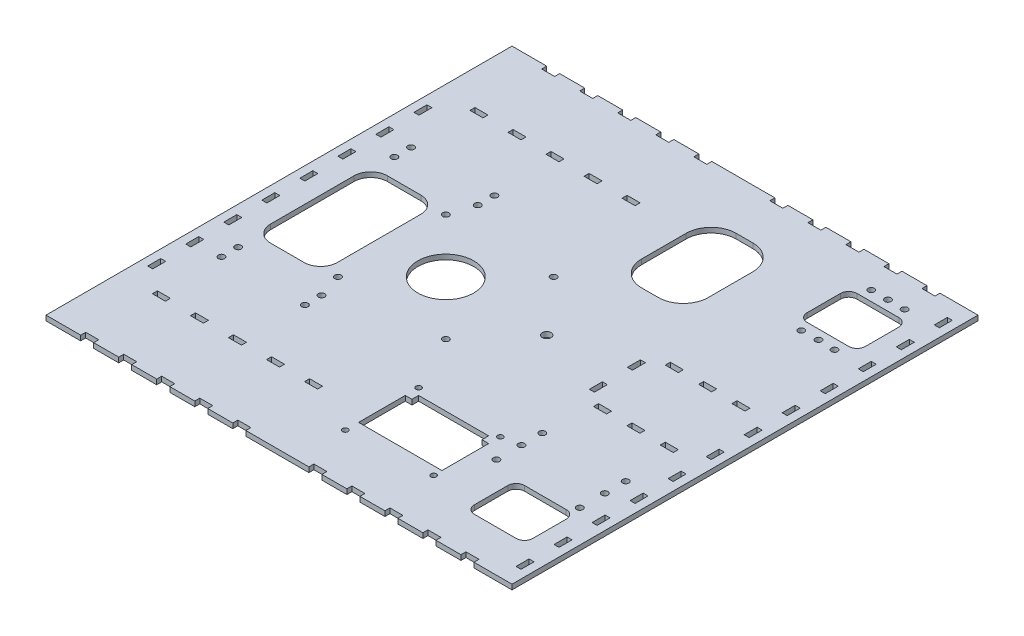
from build123d import *

# Parameters (mm, degrees)
SKETCH1_W                = 279.4
SKETCH1_H                = 279.4
BOSS_EXTRUDE1_DEPTH      = 3
SKETCH3_W                = 3
SKETCH3_H                = 7.8
CUT_EXTRUDE2_DEPTH       = 198.588410591
LPATTERN1_COUNT          = 12
LPATTERN1_PITCH          = 22.8
SKETCH5_W                = 7.8
SKETCH5_H                = 3
CUT_EXTRUDE3_DEPTH       = 198.588410591
LPATTERN2_COUNT          = 11
LPATTERN2_PITCH          = 22.8
MIRROR2_COPY_1_SKETCH_W  = 7.8
MIRROR2_COPY_1_SKETCH_H  = 3
MIRROR2_COPY_1_DEPTH     = 198.588410591
MIRROR2_COPY_2_SKETCH_W  = 7.8
MIRROR2_COPY_2_SKETCH_H  = 3
MIRROR2_COPY_2_DEPTH     = 198.588410591
MIRROR2_COPY_3_SKETCH_W  = 7.8
MIRROR2_COPY_3_SKETCH_H  = 3
MIRROR2_COPY_3_DEPTH     = 198.588410591
MIRROR2_COPY_4_SKETCH_W  = 7.8
MIRROR2_COPY_4_SKETCH_H  = 3
MIRROR2_COPY_4_DEPTH     = 198.588410591
MIRROR2_COPY_5_SKETCH_W  = 7.8
MIRROR2_COPY_5_SKETCH_H  = 3
MIRROR2_COPY_5_DEPTH     = 198.588410591
MIRROR2_COPY_6_SKETCH_W  = 7.8
MIRROR2_COPY_6_SKETCH_H  = 3
MIRROR2_COPY_6_DEPTH     = 198.588410591
MIRROR2_COPY_7_SKETCH_W  = 7.8
MIRROR2_COPY_7_SKETCH_H  = 3
MIRROR2_COPY_7_DEPTH     = 198.588410591
MIRROR2_COPY_8_SKETCH_W  = 7.8
MIRROR2_COPY_8_SKETCH_H  = 3
MIRROR2_COPY_8_DEPTH     = 198.588410591
MIRROR2_COPY_9_SKETCH_W  = 7.8
MIRROR2_COPY_9_SKETCH_H  = 3
MIRROR2_COPY_9_DEPTH     = 198.588410591
MIRROR2_COPY_10_SKETCH_W = 7.8
MIRROR2_COPY_10_SKETCH_H = 3
MIRROR2_COPY_10_DEPTH    = 198.588410591
SKETCH6_W                = 3
SKETCH6_H                = 7.8
CUT_EXTRUDE4_DEPTH       = 198.588410591
LPATTERN3_COUNT          = 8
LPATTERN3_PITCH          = 22.8
SKETCH7_R                = 16.75
CUT_EXTRUDE5_DEPTH       = 198.588410591
F_6_CLEARANCE_HOLE1_D    = 3.7973
F_6_CLEARANCE_HOLE2_D    = 3.7973
SKETCH14_R               = 2.65
CUT_EXTRUDE6_DEPTH       = 198.588410591
SKETCH16_W               = 7.8
SKETCH16_H               = 3
CUT_EXTRUDE8_DEPTH       = 198.588410591
LPATTERN5_COUNT          = 5
LPATTERN5_PITCH          = 22.8
MIRROR4_COPY_1_SKETCH_W  = 7.8
MIRROR4_COPY_1_SKETCH_H  = 3
MIRROR4_COPY_1_DEPTH     = 198.588410591
MIRROR4_COPY_2_SKETCH_W  = 7.8
MIRROR4_COPY_2_SKETCH_H  = 3
MIRROR4_COPY_2_DEPTH     = 198.588410591
MIRROR4_COPY_3_SKETCH_W  = 7.8
MIRROR4_COPY_3_SKETCH_H  = 3
MIRROR4_COPY_3_DEPTH     = 198.588410591
MIRROR4_COPY_4_SKETCH_W  = 7.8
MIRROR4_COPY_4_SKETCH_H  = 3
MIRROR4_COPY_4_DEPTH     = 198.588410591
MIRROR4_COPY_5_SKETCH_W  = 7.8
MIRROR4_COPY_5_SKETCH_H  = 3
MIRROR4_COPY_5_DEPTH     = 198.588410591
SKETCH17_W               = 7.8
SKETCH17_H               = 3
CUT_EXTRUDE9_DEPTH       = 198.588410591
LPATTERN6_COUNT          = 3
LPATTERN6_PITCH          = 20
SKETCH18_W               = 3
SKETCH18_H               = 7.8
CUT_EXTRUDE10_DEPTH      = 198.588410591
MIRROR5_COPY_1_SKETCH_W  = 7.8
MIRROR5_COPY_1_SKETCH_H  = 3
MIRROR5_COPY_1_DEPTH     = 198.588410591
MIRROR5_COPY_2_SKETCH_W  = 7.8
MIRROR5_COPY_2_SKETCH_H  = 3
MIRROR5_COPY_2_DEPTH     = 198.588410591
CUT_EXTRUDE11_DEPTH      = 198.588410591
F_4_CLEARANCE_HOLE1_D    = 3.2639
CUT_EXTRUDE12_REACH      = 199.588
F_6_CLEARANCE_HOLE3_D    = 3.7973


with BuildPart() as part:
    # Sketch1 → Boss-Extrude1 (new body)
    with BuildSketch(Plane(origin=(0, 0, 0), x_dir=(1, 0, 0), z_dir=(0, 1, 0))):
        Rectangle(SKETCH1_W, SKETCH1_H)
    extrude(amount=BOSS_EXTRUDE1_DEPTH)

    # Sketch3 → Cut-Extrude2 (cut, through all)
    with BuildSketch(Plane(origin=(0, 0, 0), x_dir=(-1, 0, 0), z_dir=(0, -1, 0))):
        with Locations((-133.2, 125.4)):
            Rectangle(SKETCH3_W, SKETCH3_H)
    cut_extrude2 = extrude(amount=-CUT_EXTRUDE2_DEPTH, mode=Mode.SUBTRACT)

    # LPattern1: Cut-Extrude2 ×12
    with Locations(*[(0, 0, i * LPATTERN1_PITCH) for i in range(1, LPATTERN1_COUNT)]):
        add(cut_extrude2, mode=Mode.SUBTRACT)

    # Sketch5 → Cut-Extrude3 (cut, through all)
    with BuildSketch(Plane.XZ):
        with Locations((113, -138.2)):
            Rectangle(SKETCH5_W, SKETCH5_H)
    cut_extrude3 = extrude(amount=-CUT_EXTRUDE3_DEPTH, mode=Mode.SUBTRACT)

    # LPattern2: Cut-Extrude3 ×11, 1 skipped
    with Locations(*[(-i * LPATTERN2_PITCH, 0, 0) for i in range(1, LPATTERN2_COUNT) if i not in (5,)]):
        add(cut_extrude3, mode=Mode.SUBTRACT)

    # Mirror2 copy 1 sketch → Mirror2 copy 1 (cut, through all)
    with BuildSketch(Plane(origin=(-22.8, 0, 0), x_dir=(1, 0, 0), z_dir=(0, -1, 0))):
        with Locations((113, 138.2)):
            Rectangle(MIRROR2_COPY_1_SKETCH_W, MIRROR2_COPY_1_SKETCH_H)
    extrude(amount=-MIRROR2_COPY_1_DEPTH, mode=Mode.SUBTRACT)

    # Mirror2 copy 2 sketch → Mirror2 copy 2 (cut, through all)
    with BuildSketch(Plane(origin=(-45.6, 0, 0), x_dir=(1, 0, 0), z_dir=(0, -1, 0))):
        with Locations((113, 138.2)):
            Rectangle(MIRROR2_COPY_2_SKETCH_W, MIRROR2_COPY_2_SKETCH_H)
    extrude(amount=-MIRROR2_COPY_2_DEPTH, mode=Mode.SUBTRACT)

    # Mirror2 copy 3 sketch → Mirror2 copy 3 (cut, through all)
    with BuildSketch(Plane(origin=(-68.4, 0, 0), x_dir=(1, 0, 0), z_dir=(0, -1, 0))):
        with Locations((113, 138.2)):
            Rectangle(MIRROR2_COPY_3_SKETCH_W, MIRROR2_COPY_3_SKETCH_H)
    extrude(amount=-MIRROR2_COPY_3_DEPTH, mode=Mode.SUBTRACT)

    # Mirror2 copy 4 sketch → Mirror2 copy 4 (cut, through all)
    with BuildSketch(Plane(origin=(-91.2, 0, 0), x_dir=(1, 0, 0), z_dir=(0, -1, 0))):
        with Locations((113, 138.2)):
            Rectangle(MIRROR2_COPY_4_SKETCH_W, MIRROR2_COPY_4_SKETCH_H)
    extrude(amount=-MIRROR2_COPY_4_DEPTH, mode=Mode.SUBTRACT)

    # Mirror2 copy 5 sketch → Mirror2 copy 5 (cut, through all)
    with BuildSketch(Plane(origin=(-136.8, 0, 0), x_dir=(1, 0, 0), z_dir=(0, -1, 0))):
        with Locations((113, 138.2)):
            Rectangle(MIRROR2_COPY_5_SKETCH_W, MIRROR2_COPY_5_SKETCH_H)
    extrude(amount=-MIRROR2_COPY_5_DEPTH, mode=Mode.SUBTRACT)

    # Mirror2 copy 6 sketch → Mirror2 copy 6 (cut, through all)
    with BuildSketch(Plane(origin=(-159.6, 0, 0), x_dir=(1, 0, 0), z_dir=(0, -1, 0))):
        with Locations((113, 138.2)):
            Rectangle(MIRROR2_COPY_6_SKETCH_W, MIRROR2_COPY_6_SKETCH_H)
    extrude(amount=-MIRROR2_COPY_6_DEPTH, mode=Mode.SUBTRACT)

    # Mirror2 copy 7 sketch → Mirror2 copy 7 (cut, through all)
    with BuildSketch(Plane(origin=(-182.4, 0, 0), x_dir=(1, 0, 0), z_dir=(0, -1, 0))):
        with Locations((113, 138.2)):
            Rectangle(MIRROR2_COPY_7_SKETCH_W, MIRROR2_COPY_7_SKETCH_H)
    extrude(amount=-MIRROR2_COPY_7_DEPTH, mode=Mode.SUBTRACT)

    # Mirror2 copy 8 sketch → Mirror2 copy 8 (cut, through all)
    with BuildSketch(Plane(origin=(-205.2, 0, 0), x_dir=(1, 0, 0), z_dir=(0, -1, 0))):
        with Locations((113, 138.2)):
            Rectangle(MIRROR2_COPY_8_SKETCH_W, MIRROR2_COPY_8_SKETCH_H)
    extrude(amount=-MIRROR2_COPY_8_DEPTH, mode=Mode.SUBTRACT)

    # Mirror2 copy 9 sketch → Mirror2 copy 9 (cut, through all)
    with BuildSketch(Plane(origin=(-228, 0, 0), x_dir=(1, 0, 0), z_dir=(0, -1, 0))):
        with Locations((113, 138.2)):
            Rectangle(MIRROR2_COPY_9_SKETCH_W, MIRROR2_COPY_9_SKETCH_H)
    extrude(amount=-MIRROR2_COPY_9_DEPTH, mode=Mode.SUBTRACT)

    # Mirror2 copy 10 sketch → Mirror2 copy 10 (cut, through all)
    with BuildSketch(Plane.XZ):
        with Locations((113, 138.2)):
            Rectangle(MIRROR2_COPY_10_SKETCH_W, MIRROR2_COPY_10_SKETCH_H)
    extrude(amount=-MIRROR2_COPY_10_DEPTH, mode=Mode.SUBTRACT)

    # Sketch6 → Cut-Extrude4 (cut, through all)
    with BuildSketch(Plane.XZ):
        with Locations((-133.2, -79.8)):
            Rectangle(SKETCH6_W, SKETCH6_H)
    cut_extrude4 = extrude(amount=-CUT_EXTRUDE4_DEPTH, mode=Mode.SUBTRACT)

    # LPattern3: Cut-Extrude4 ×8
    with Locations(*[(0, 0, i * LPATTERN3_PITCH) for i in range(1, LPATTERN3_COUNT)]):
        add(cut_extrude4, mode=Mode.SUBTRACT)

    # Sketch7 → Cut-Extrude5 (cut, through all)
    with BuildSketch(Plane(origin=(0, 0, 0), x_dir=(-1, 0, 0), z_dir=(0, -1, 0))):
        with Locations((39.7, 0)):
            Circle(SKETCH7_R)
    extrude(amount=-CUT_EXTRUDE5_DEPTH, mode=Mode.SUBTRACT)

    # #6 Clearance Hole1 (through all)
    with Locations(Plane(origin=(0, 3, 0), x_dir=(1, 0, 0), z_dir=(0, 1, 0))):
        with Locations((-72.025, -32.325), (-72.025, 32.325), (-7.375, 32.325), (-7.375, -32.325)):
            Hole(F_6_CLEARANCE_HOLE1_D / 2)

    # #6 Clearance Hole2 (through all)
    with Locations(Plane(origin=(0, 3, 0), x_dir=(1, 0, 0), z_dir=(0, 1, 0))):
        with Locations((-117.36, 56.83), (-67.36, 56.83), (-117.36, -56.83), (-67.36, -56.83), (-67.36, -46.83), (-117.36, -46.83), (-67.36, 46.83), (-117.36, 46.83)):
            Hole(F_6_CLEARANCE_HOLE2_D / 2)

    # Sketch14 → Cut-Extrude6 (cut, through all)
    with BuildSketch(Plane(origin=(0, 0, 0), x_dir=(-1, 0, 0), z_dir=(0, -1, 0))):
        with Locations((-20.8, 0)):
            Circle(SKETCH14_R)
    extrude(amount=-CUT_EXTRUDE6_DEPTH, mode=Mode.SUBTRACT)

    # Sketch16 → Cut-Extrude8 (cut, through all)
    with BuildSketch(Plane.XZ):
        with Locations((-115, 95.2)):
            Rectangle(SKETCH16_W, SKETCH16_H)
    cut_extrude8 = extrude(amount=-CUT_EXTRUDE8_DEPTH, mode=Mode.SUBTRACT)

    # LPattern5: Cut-Extrude8 ×5
    with Locations(*[(i * LPATTERN5_PITCH, 0, 0) for i in range(1, LPATTERN5_COUNT)]):
        add(cut_extrude8, mode=Mode.SUBTRACT)

    # Mirror4 copy 1 sketch → Mirror4 copy 1 (cut, through all)
    with BuildSketch(Plane(origin=(22.8, 0, 0), x_dir=(1, 0, 0), z_dir=(0, -1, 0))):
        with Locations((-115, -95.2)):
            Rectangle(MIRROR4_COPY_1_SKETCH_W, MIRROR4_COPY_1_SKETCH_H)
    extrude(amount=-MIRROR4_COPY_1_DEPTH, mode=Mode.SUBTRACT)

    # Mirror4 copy 2 sketch → Mirror4 copy 2 (cut, through all)
    with BuildSketch(Plane(origin=(45.6, 0, 0), x_dir=(1, 0, 0), z_dir=(0, -1, 0))):
        with Locations((-115, -95.2)):
            Rectangle(MIRROR4_COPY_2_SKETCH_W, MIRROR4_COPY_2_SKETCH_H)
    extrude(amount=-MIRROR4_COPY_2_DEPTH, mode=Mode.SUBTRACT)

    # Mirror4 copy 3 sketch → Mirror4 copy 3 (cut, through all)
    with BuildSketch(Plane(origin=(68.4, 0, 0), x_dir=(1, 0, 0), z_dir=(0, -1, 0))):
        with Locations((-115, -95.2)):
            Rectangle(MIRROR4_COPY_3_SKETCH_W, MIRROR4_COPY_3_SKETCH_H)
    extrude(amount=-MIRROR4_COPY_3_DEPTH, mode=Mode.SUBTRACT)

    # Mirror4 copy 4 sketch → Mirror4 copy 4 (cut, through all)
    with BuildSketch(Plane(origin=(91.2, 0, 0), x_dir=(1, 0, 0), z_dir=(0, -1, 0))):
        with Locations((-115, -95.2)):
            Rectangle(MIRROR4_COPY_4_SKETCH_W, MIRROR4_COPY_4_SKETCH_H)
    extrude(amount=-MIRROR4_COPY_4_DEPTH, mode=Mode.SUBTRACT)

    # Mirror4 copy 5 sketch → Mirror4 copy 5 (cut, through all)
    with BuildSketch(Plane.XZ):
        with Locations((-115, -95.2)):
            Rectangle(MIRROR4_COPY_5_SKETCH_W, MIRROR4_COPY_5_SKETCH_H)
    extrude(amount=-MIRROR4_COPY_5_DEPTH, mode=Mode.SUBTRACT)

    # Sketch17 → Cut-Extrude9 (cut, through all)
    with BuildSketch(Plane.XZ):
        with Locations((115.8, 21.5)):
            Rectangle(SKETCH17_W, SKETCH17_H)
    cut_extrude9 = extrude(amount=-CUT_EXTRUDE9_DEPTH, mode=Mode.SUBTRACT)

    # LPattern6: Cut-Extrude9 ×3
    with Locations(*[(-i * LPATTERN6_PITCH, 0, 0) for i in range(1, LPATTERN6_COUNT)]):
        add(cut_extrude9, mode=Mode.SUBTRACT)

    # Sketch18 → Cut-Extrude10 (cut, through all)
    with BuildSketch(Plane(origin=(0, 0, 0), x_dir=(-1, 0, 0), z_dir=(0, -1, 0))):
        with Locations((-63.2, -11.4)):
            Rectangle(SKETCH18_W, SKETCH18_H)
    cut_extrude10 = extrude(amount=-CUT_EXTRUDE10_DEPTH, mode=Mode.SUBTRACT)

    # Mirror5: Cut-Extrude9, Cut-Extrude10 across plane
    add(cut_extrude9.mirror(Plane.XY), mode=Mode.SUBTRACT)
    add(cut_extrude10.mirror(Plane.XY), mode=Mode.SUBTRACT)

    # Mirror5 copy 1 sketch → Mirror5 copy 1 (cut, through all)
    with BuildSketch(Plane(origin=(-20, 0, 0), x_dir=(1, 0, 0), z_dir=(0, -1, 0))):
        with Locations((115.8, -21.5)):
            Rectangle(MIRROR5_COPY_1_SKETCH_W, MIRROR5_COPY_1_SKETCH_H)
    extrude(amount=-MIRROR5_COPY_1_DEPTH, mode=Mode.SUBTRACT)

    # Mirror5 copy 2 sketch → Mirror5 copy 2 (cut, through all)
    with BuildSketch(Plane(origin=(-40, 0, 0), x_dir=(1, 0, 0), z_dir=(0, -1, 0))):
        with Locations((115.8, -21.5)):
            Rectangle(MIRROR5_COPY_2_SKETCH_W, MIRROR5_COPY_2_SKETCH_H)
    extrude(amount=-MIRROR5_COPY_2_DEPTH, mode=Mode.SUBTRACT)

    # Sketch19 → Cut-Extrude11 (cut, through all)
    with BuildSketch(Plane.XZ):
        with BuildLine():
            Line((24.7, -109.7), (34.7, -109.7))
            ThreePointArc((34.7, -109.7), (45.306601718, -105.306601718), (49.7, -94.7))
            Line((49.7, -94.7), (49.7, -68))
            ThreePointArc((49.7, -68), (45.306601718, -57.393398282), (34.7, -53))
            Line((34.7, -53), (24.7, -53))
            ThreePointArc((24.7, -53), (14.093398282, -57.393398282), (9.7, -68))
            Line((9.7, -68), (9.7, -94.7))
            ThreePointArc((9.7, -94.7), (14.093398282, -105.306601718), (24.7, -109.7))
        make_face()
        with BuildLine():
            Line((-89.7, 35), (-109.7, 35))
            ThreePointArc((-109.7, 35), (-116.771067812, 32.071067812), (-119.7, 25))
            Line((-119.7, 25), (-119.7, -25))
            ThreePointArc((-119.7, -25), (-116.771067812, -32.071067812), (-109.7, -35))
            Line((-109.7, -35), (-89.7, -35))
            ThreePointArc((-89.7, -35), (-82.628932188, -32.071067812), (-79.7, -25))
            Line((-79.7, -25), (-79.7, 25))
            ThreePointArc((-79.7, 25), (-82.628932188, 32.071067812), (-89.7, 35))
        make_face()
        Polygon((9.7, 101.7), (59.7, 101.7), (59.7, 73.7), (55.7, 73.7), (55.7, 69.7), (13.7, 69.7), (13.7, 73.7), (9.7, 73.7), align=None)
    extrude(amount=-CUT_EXTRUDE11_DEPTH, mode=Mode.SUBTRACT)

    # #4 Clearance Hole1 (through all)
    with Locations(Plane(origin=(0, 3, 0), x_dir=(1, 0, 0), z_dir=(0, 1, 0))):
        with Locations((9.7, -65.7), (59.7, -66.7), (59.7, -106.7), (9.7, -109.7)):
            Hole(F_4_CLEARANCE_HOLE1_D / 2)

    # Sketch22 → Cut-Extrude12 (cut, up to next)
    with BuildSketch(Plane(origin=(0, 3, 0), x_dir=(1, 0, 0), z_dir=(0, 1, 0)), mode=Mode.PRIVATE) as cut_extrude12_sk1:
        with BuildLine():
            Line((117.2, -84.7), (92.2, -84.7))
            ThreePointArc((92.2, -84.7), (88.664466094, -86.164466094), (87.2, -89.7))
            Line((87.2, -89.7), (87.2, -109.7))
            ThreePointArc((87.2, -109.7), (88.664466094, -113.235533906), (92.2, -114.7))
            Line((92.2, -114.7), (117.2, -114.7))
            ThreePointArc((117.2, -114.7), (120.735533906, -113.235533906), (122.2, -109.7))
            Line((122.2, -109.7), (122.2, -89.7))
            ThreePointArc((122.2, -89.7), (120.735533906, -86.164466094), (117.2, -84.7))
        make_face()
    cut_extrude12_tool1 = extrude(cut_extrude12_sk1.sketch, amount=-CUT_EXTRUDE12_REACH, mode=Mode.PRIVATE) & part.part
    # Sketch22 → Cut-Extrude12 (cut, up to next)
    with BuildSketch(Plane(origin=(0, 3, 0), x_dir=(1, 0, 0), z_dir=(0, 1, 0)), mode=Mode.PRIVATE) as cut_extrude12_sk2:
        with BuildLine():
            Line((117.2, 114.7), (92.2, 114.7))
            ThreePointArc((92.2, 114.7), (88.664466094, 113.235533906), (87.2, 109.7))
            Line((87.2, 109.7), (87.2, 89.7))
            ThreePointArc((87.2, 89.7), (88.664466094, 86.164466094), (92.2, 84.7))
            Line((92.2, 84.7), (117.2, 84.7))
            ThreePointArc((117.2, 84.7), (120.735533906, 86.164466094), (122.2, 89.7))
            Line((122.2, 89.7), (122.2, 109.7))
            ThreePointArc((122.2, 109.7), (120.735533906, 113.235533906), (117.2, 114.7))
        make_face()
    cut_extrude12_tool2 = extrude(cut_extrude12_sk2.sketch, amount=-CUT_EXTRUDE12_REACH, mode=Mode.PRIVATE) & part.part
    add(cut_extrude12_tool1.solids().sort_by_distance((104.7, 3, 99.7))[0], mode=Mode.SUBTRACT)
    add(cut_extrude12_tool2.solids().sort_by_distance((104.7, 3, -99.7))[0], mode=Mode.SUBTRACT)

    # #6 Clearance Hole3 (through all)
    with Locations(Plane(origin=(0, 3, 0), x_dir=(1, 0, 0), z_dir=(0, 1, 0))):
        with Locations((94.7, 120.7), (114.7, 120.7), (114.7, 78.7), (94.7, 78.7), (104.7, 79.030891432), (104.7, 120.7), (70.35, -52.2), (70.35, -79.7), (70.35, -64.7), (120.35, -64.7), (120.35, -52.2), (120.35, -79.7)):
            Hole(F_6_CLEARANCE_HOLE3_D / 2)


solid = part.part
